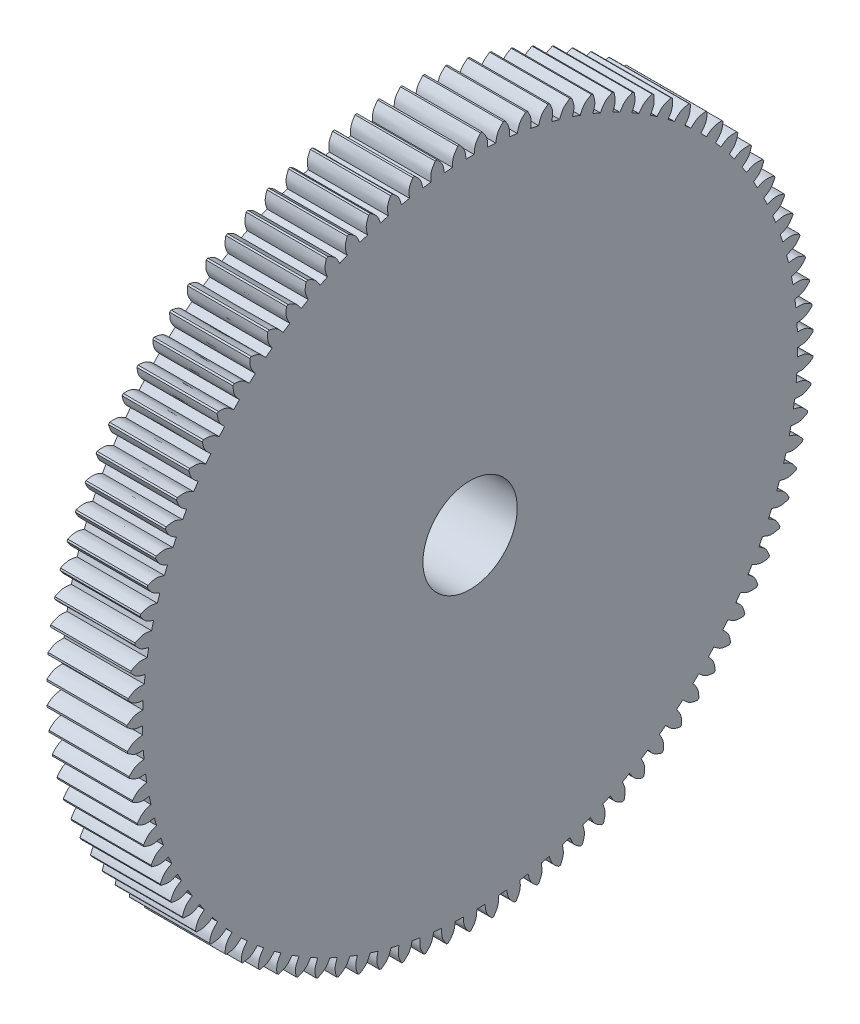
from build123d import *

# Parameters (mm, degrees)
RITNING_1_W      = 17
RITNING_1_H      = 62.75
KUGGLUCKA_DEPTH  = 17
CIRPATTERN_COUNT = 95


with BuildPart() as part:
    # Ritning 1 → Kugghjulsämne (revolve)
    with BuildSketch(Plane.XY, mode=Mode.PRIVATE) as kugghjuls_mne_sk:
        with Locations((0, 5)):
            Rectangle(RITNING_1_W, RITNING_1_H)
    revolve(kugghjuls_mne_sk.sketch.rotate(Axis((-8.5, -36.375, 0), (1, 0, 0)), 90), axis=Axis((-8.5, -36.375, 0), (1, 0, 0)))

    # Ritning 2 → Kugglucka (cut)
    with BuildSketch(Plane.ZY.offset(8.5)):
        with BuildLine():
            Line((2.211683244, 36.341373378), (0, 38.553056622))
            Line((0, 38.553056622), (-2.211683244, 36.341373378))
            add(Edge.make_bspline(
                [(-2.211683244, 36.341373378), (-1.807451475, 35.874065285), (-0.994209671, 34.933925234), (-0.905898856, 33.693508937), (-0.86148401, 33.069656708)],
                knots=[0, 0, 0, 0, 0.497062212, 1, 1, 1, 1], degree=3))
            ThreePointArc((-0.86148401, 33.069656708), (0, 33.075), (0.86148401, 33.069656708))
            add(Edge.make_bspline(
                [(2.211683244, 36.341373378), (1.807451475, 35.874065285), (0.994209671, 34.933925234), (0.905898856, 33.693508937), (0.86148401, 33.069656708)],
                knots=[0, 0, 0, 0, 0.497062212, 1, 1, 1, 1], degree=3))
        make_face()
    kugglucka = extrude(amount=-KUGGLUCKA_DEPTH, mode=Mode.SUBTRACT)

    # CirPattern: Kugglucka ×95 about axis
    cirpattern_axis = Axis((-8.5, -36.375, 0), (-1, 0, 0))
    for i in range(1, CIRPATTERN_COUNT):
        add(kugglucka.rotate(cirpattern_axis, i * 360 / CIRPATTERN_COUNT), mode=Mode.SUBTRACT)


solid = part.part
